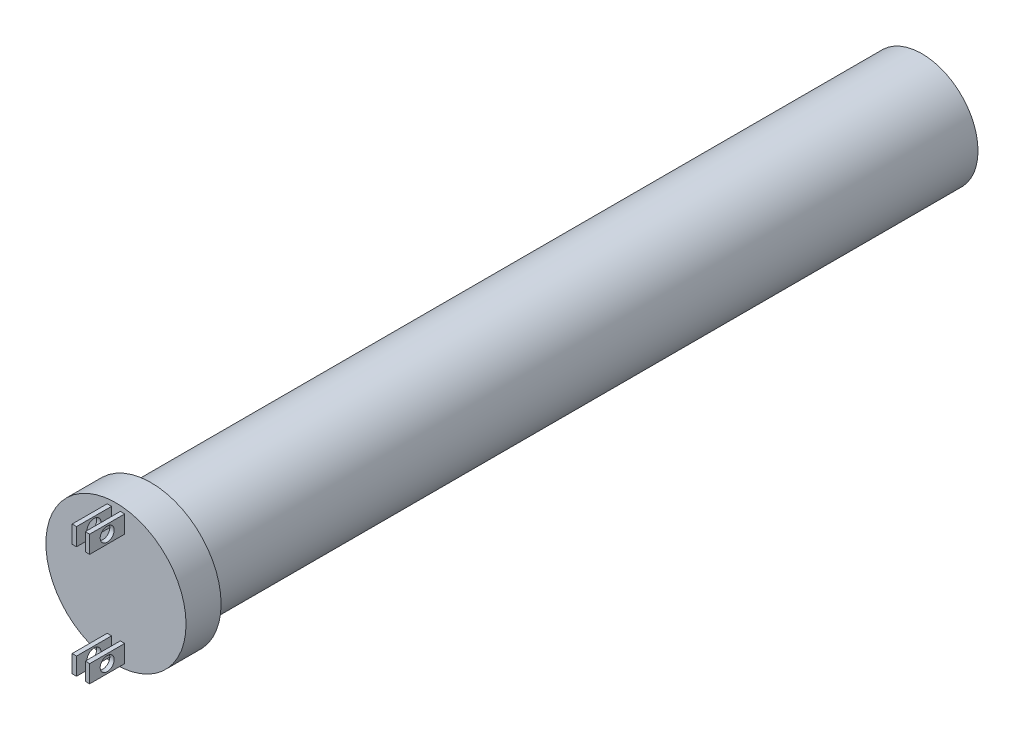
from build123d import *

# Parameters (mm, degrees)
SKETCH1_R           = 20.32
BOSS_EXTRUDE1_DEPTH = 279.4
SKETCH2_R           = 25.4
BOSS_EXTRUDE2_DEPTH = 12.7
SKETCH3_W           = 6.35
SKETCH3_H           = 6.35
BOSS_EXTRUDE3_DEPTH = 12.7
SKETCH4_R           = 2.54
CUT_EXTRUDE1_DEPTH  = 6.35
CUT_EXTRUDE2_START  = -1.5875
SKETCH5_W           = 12.7
SKETCH5_H           = 6.35
CUT_EXTRUDE2_DEPTH  = 3.175


with BuildPart() as part:
    # Sketch1 → Boss-Extrude1 (new body)
    with BuildSketch(Plane.XY):
        Circle(SKETCH1_R)
    extrude(amount=BOSS_EXTRUDE1_DEPTH)

    # Sketch2 → Boss-Extrude2 (add)
    with BuildSketch(Plane.XY.offset(279.4)):
        Circle(SKETCH2_R)
    extrude(amount=BOSS_EXTRUDE2_DEPTH)

    # Sketch3 → Boss-Extrude3 (add)
    with BuildSketch(Plane.XY.offset(292.1)):
        Polygon((-3.175, 23.495), (-3.175, 17.145), (0, 17.145), (3.175, 17.145), (3.175, 23.495), align=None)
        with Locations((0, -20.32)):
            Rectangle(SKETCH3_W, SKETCH3_H)
    extrude(amount=BOSS_EXTRUDE3_DEPTH)

    # Sketch4 → Cut-Extrude1 (cut)
    with BuildSketch(Plane.ZY.offset(3.175)):
        with Locations((298.45, 20.32)):
            Circle(SKETCH4_R)
        with Locations((298.45, -20.32)):
            Circle(SKETCH4_R)
    extrude(amount=-CUT_EXTRUDE1_DEPTH, mode=Mode.SUBTRACT)

    # Sketch5 → Cut-Extrude2 (cut)
    with BuildSketch(Plane(origin=(3.175, 0, 0), x_dir=(0, 0, -1), z_dir=(1, 0, 0)).offset(CUT_EXTRUDE2_START)):
        with Locations((-298.45, -20.32)):
            Rectangle(SKETCH5_W, SKETCH5_H)
    cut_extrude2 = extrude(amount=-CUT_EXTRUDE2_DEPTH, mode=Mode.SUBTRACT)

    # Mirror1: Cut-Extrude2 across plane
    add(cut_extrude2.mirror(Plane.ZX), mode=Mode.SUBTRACT)


solid = part.part
